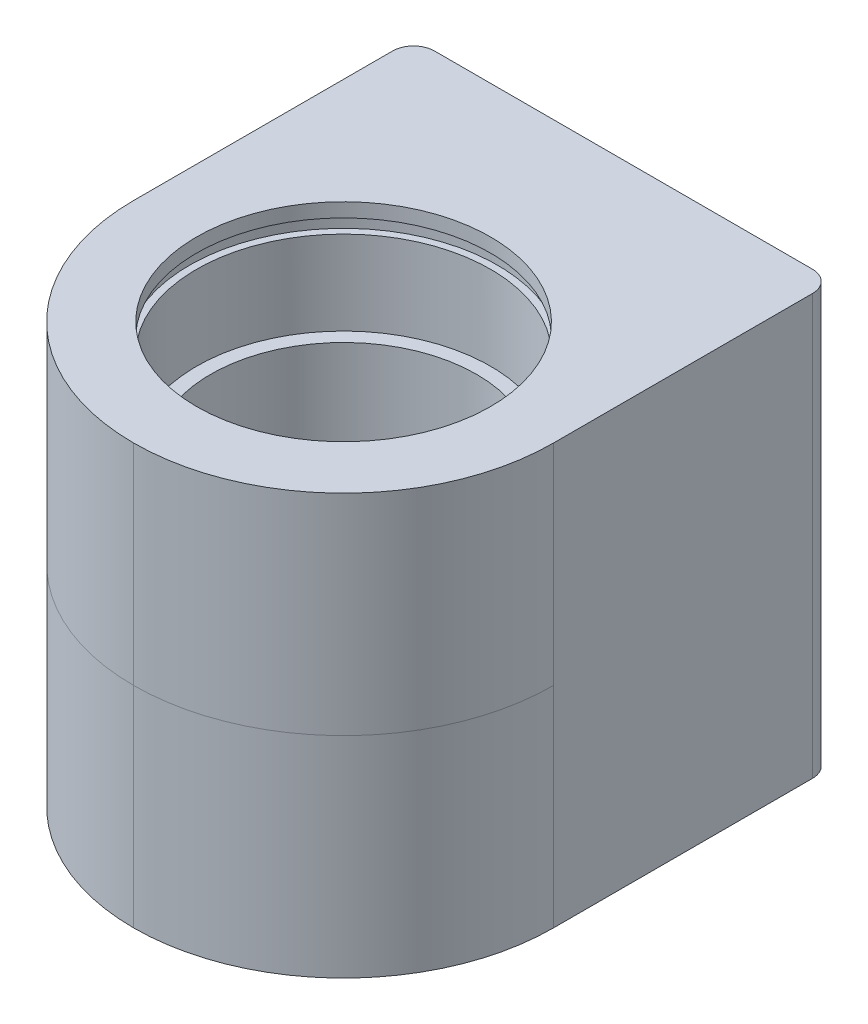
from build123d import *

# Parameters (mm, degrees)
SKIZZE1_W                                            = 60
SKIZZE1_H                                            = 30
AUFSATZ_LINEAR_AUSTRAGEN1_DEPTH                      = 70
VERRUNDUNG1_R                                        = 30
STIRNSENKUNG_F_R_M42_ZYLINDERSCHRAUBE_MI_D           = 38
STIRNSENKUNG_F_R_M42_ZYLINDERSCHRAUBE_MI_CBORE_D     = 42
STIRNSENKUNG_F_R_M42_ZYLINDERSCHRAUBE_MI_CBORE_DEPTH = 16
SKIZZE4_R                                            = 22
SCHNITT_LINEAR_AUSTRAGEN1_DEPTH                      = 1
VERRUNDUNG1_OF_SPIEGELN1_R                           = 30
M6_GEWINDEBOHRUNG1_D                                 = 5
M6_GEWINDEBOHRUNG1_DEPTH                             = 20
M6_GEWINDEBOHRUNG1_TIP                               = 1.502151548
VERRUNDUNG2_R                                        = 3


with BuildPart() as part:
    # Skizze1 → Aufsatz-Linear austragen1 (new body)
    with BuildSketch(Plane.XY):
        Rectangle(SKIZZE1_W, SKIZZE1_H)
    aufsatz_linear_austragen1 = extrude(amount=AUFSATZ_LINEAR_AUSTRAGEN1_DEPTH)

    # Verrundung1
    verrundung1_edges = [part.edges().sort_by_distance(p)[0] for p in [
        (30, 0, 70),
        (-30, 0, 70),
    ]]
    fillet(verrundung1_edges, radius=VERRUNDUNG1_R - 0.0001)  # a hair under: the kernel refuses the full size

    # Stirnsenkung für M42 Zylinderschraube mit Innensechskant1 (through all)
    with Locations(Plane(origin=(0, -15, 0), x_dir=(-1, 0, 0), z_dir=(0, -1, 0))):
        with Locations((0, -40)):
            stirnsenkung_f_r_m42_zylinderschraube_mi = CounterBoreHole(STIRNSENKUNG_F_R_M42_ZYLINDERSCHRAUBE_MI_D / 2, STIRNSENKUNG_F_R_M42_ZYLINDERSCHRAUBE_MI_CBORE_D / 2, STIRNSENKUNG_F_R_M42_ZYLINDERSCHRAUBE_MI_CBORE_DEPTH)

    # Skizze4 → Schnitt-Linear austragen1 (cut, symmetric)
    with BuildSketch(Plane(origin=(0, -12, 0), x_dir=(1, 0, 0), z_dir=(0, 1, 0))):
        with Locations(Location((0, -40, 0), (0, 0, 270))):
            Circle(SKIZZE4_R)
    schnitt_linear_austragen1 = extrude(amount=SCHNITT_LINEAR_AUSTRAGEN1_DEPTH, both=True, mode=Mode.SUBTRACT)

    # Spiegeln1: Aufsatz-Linear austragen1, Stirnsenkung für M42 Zylinderschraube mit Innensechskant1, Schnitt-Linear austragen1 across plane
    add(aufsatz_linear_austragen1.mirror(Plane(origin=(30, 15, 70), x_dir=(0, 0, 1), z_dir=(0, -1, 0))))
    add(stirnsenkung_f_r_m42_zylinderschraube_mi.mirror(Plane(origin=(30, 15, 70), x_dir=(0, 0, 1), z_dir=(0, -1, 0))), mode=Mode.SUBTRACT)
    add(schnitt_linear_austragen1.mirror(Plane(origin=(30, 15, 70), x_dir=(0, 0, 1), z_dir=(0, -1, 0))), mode=Mode.SUBTRACT)

    # Verrundung1 of Spiegeln1
    verrundung1_of_spiegeln1_edges = [part.edges().sort_by_distance(p)[0] for p in [
        (30, 30, 70),
        (-30, 30, 70),
    ]]
    fillet(verrundung1_of_spiegeln1_edges, radius=VERRUNDUNG1_OF_SPIEGELN1_R - 0.0001)  # a hair under: the kernel refuses the full size

    # M6 Gewindebohrung1
    with Locations(Plane(origin=(0, 0, 0), x_dir=(-1, 0, 0), z_dir=(0, 0, -1))):
        with Locations((-20, 35), (20, 35), (-20, -5), (20, -5)):
            Hole(M6_GEWINDEBOHRUNG1_D / 2, depth=M6_GEWINDEBOHRUNG1_DEPTH)
            with Locations((0, 0, -(M6_GEWINDEBOHRUNG1_DEPTH + M6_GEWINDEBOHRUNG1_TIP / 2))):  # 118° drill point
                Cone(0, M6_GEWINDEBOHRUNG1_D / 2, M6_GEWINDEBOHRUNG1_TIP, mode=Mode.SUBTRACT)

    # Verrundung2
    verrundung2_edges = [part.edges().sort_by_distance(p)[0] for p in [
        (30, 15, 0),
        (-30, 15, 0),
    ]]
    fillet(verrundung2_edges, radius=VERRUNDUNG2_R)


solid = part.part
